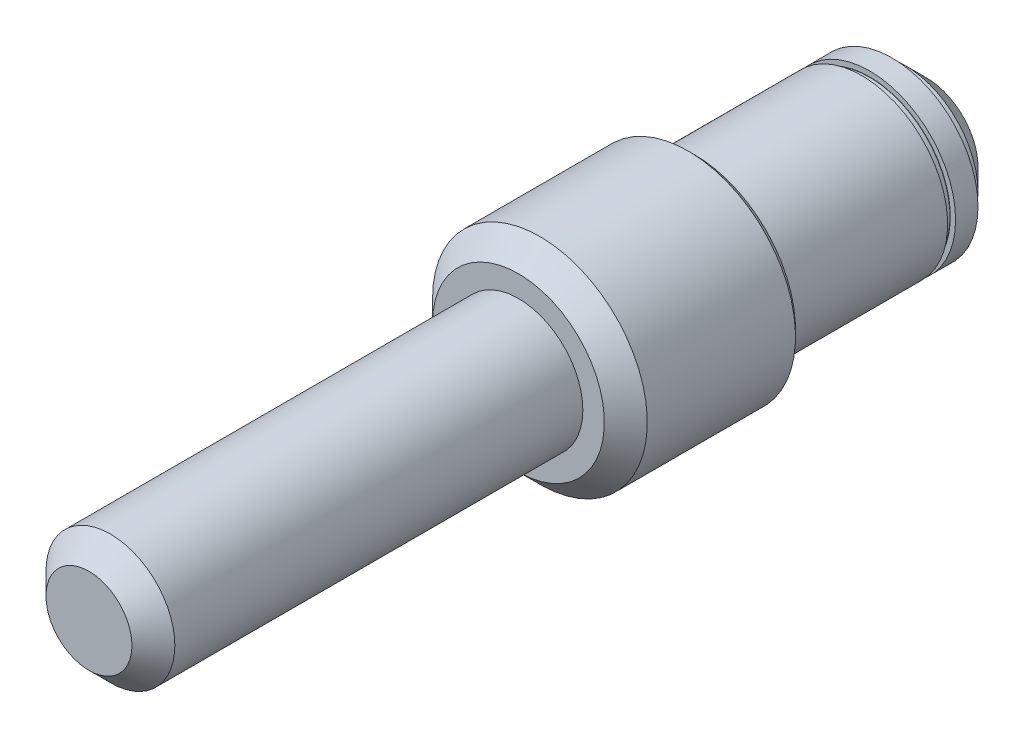
from build123d import *

# Parameters (mm, degrees)
CHAMFER_1_SIZE      = 5
SKETCH_4_R          = 20
SKETCH_4_R_2        = 18.75
CUT_EXTRUDE_1_DEPTH = 1.85
FILLET_1_R          = 0.05
CHAMFER_2_SIZE      = 1.5
SKETCH_9_R          = 25
SKETCH_9_R_2        = 20
CUT_EXTRUDE_4_DEPTH = 6
CHAMFER_3_SIZE      = 1.5


with BuildPart() as part:
    # Эскиз1 → Повернуть1 (revolve)
    with BuildSketch(Plane(origin=(0, 0, 0), x_dir=(0, 0, -1), z_dir=(1, 0, 0))):
        Polygon((0, 0), (0, 15), (100, 15), (100, 25), (147, 25), (147, 20), (187, 20), (187, 17), (195, 17), (195, 5), (190, 0), align=None)
    revolve(axis=Axis((0, 0, 0), (0, 0, -1)))

    # Фаска1
    chamfer_1_edges = [part.edges().sort_by_distance(p)[0] for p in [
        (0, -25, -100),
        (0, -15, 0),
        (0, -17, -195),
    ]]
    chamfer(chamfer_1_edges, length=CHAMFER_1_SIZE)

    # Эскиз4 → Вырез-Вытянуть1 (cut)
    with BuildSketch(Plane(origin=(0, 0, -181.775), x_dir=(-1, 0, 0), z_dir=(0, 0, -1))):
        Circle(SKETCH_4_R)
        Circle(SKETCH_4_R_2, mode=Mode.SUBTRACT)
    extrude(amount=-CUT_EXTRUDE_1_DEPTH, mode=Mode.SUBTRACT)

    # Скругление1
    fillet_1_edges = [part.edges().sort_by_distance(p)[0] for p in [
        (18.75, 0, -179.925),
        (18.75, 0, -181.775),
    ]]
    fillet(fillet_1_edges, radius=FILLET_1_R)

    # Фаска2
    chamfer_2_edges = [part.edges().sort_by_distance(p)[0] for p in [
        (0, -25, -147),
    ]]
    chamfer(chamfer_2_edges, length=CHAMFER_2_SIZE)

    # Эскиз9 → Вырез-Вытянуть4 (cut)
    with BuildSketch(Plane(origin=(0, 0, -147), x_dir=(-1, 0, 0), z_dir=(0, 0, -1))):
        Circle(SKETCH_9_R)
        Circle(SKETCH_9_R_2, mode=Mode.SUBTRACT)
    extrude(amount=-CUT_EXTRUDE_4_DEPTH, mode=Mode.SUBTRACT)

    # Фаска3
    chamfer_3_edges = [part.edges().sort_by_distance(p)[0] for p in [
        (0, -25, -141),
    ]]
    chamfer(chamfer_3_edges, length=CHAMFER_3_SIZE)


solid = part.part
